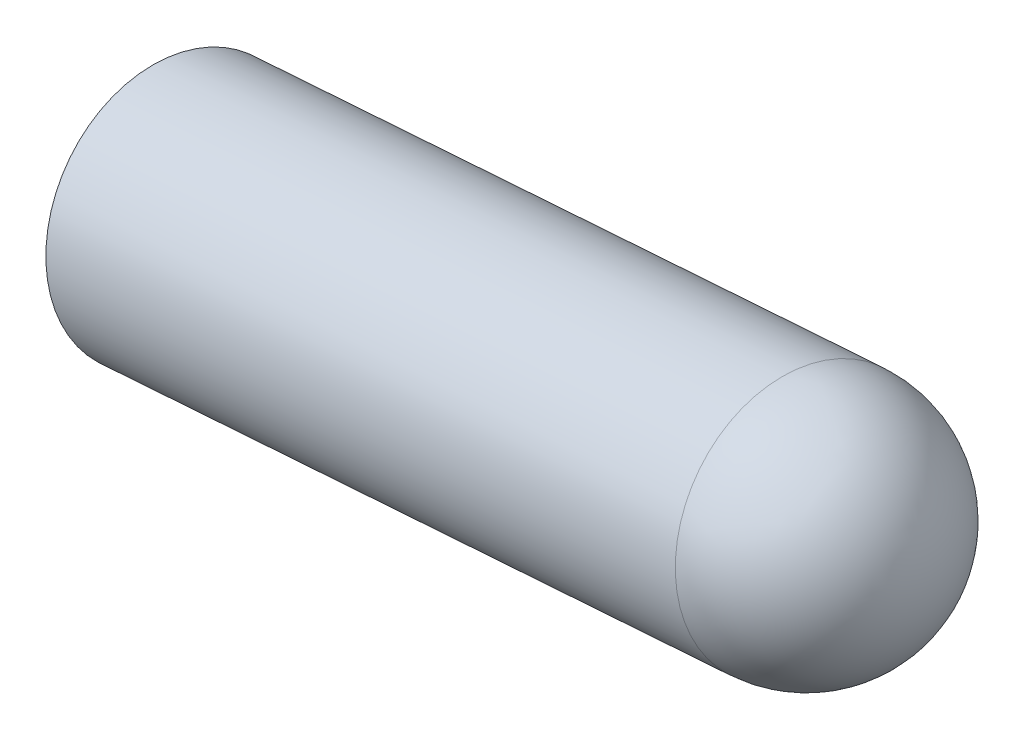
from build123d import *

# Parameters (mm, degrees)
SKETCH1_R           = 15
BOSS_EXTRUDE1_DEPTH = 100
FILLET1_R           = 15


# Read off the part's stored shape, not the designer's step: Bill Native-21-surface1
with BuildPart() as part:
    # Sketch1 → Boss-Extrude1 (new body)
    with BuildSketch(Plane(origin=(-117.976475724, -16.532382314, -8.744573294), x_dir=(-0.07249877007655836, -0.010159460831791603, 0.9973167569498639), z_dir=(-0.9876663912776456, -0.13840452750393129, -0.07320714655692012))):
        with Locations(Location((-65.534620891, -208.354190219, 0), (0, 0, 270))):
            Circle(SKETCH1_R)
    extrude(amount=-BOSS_EXTRUDE1_DEPTH)

    # Fillet1
    fillet1_edges = [part.edges().sort_by_distance(p)[0] for p in [
        (12.37443787, -193.509364491, -66.782634214),
    ]]
    fillet(fillet1_edges, radius=FILLET1_R)


solid = part.part
